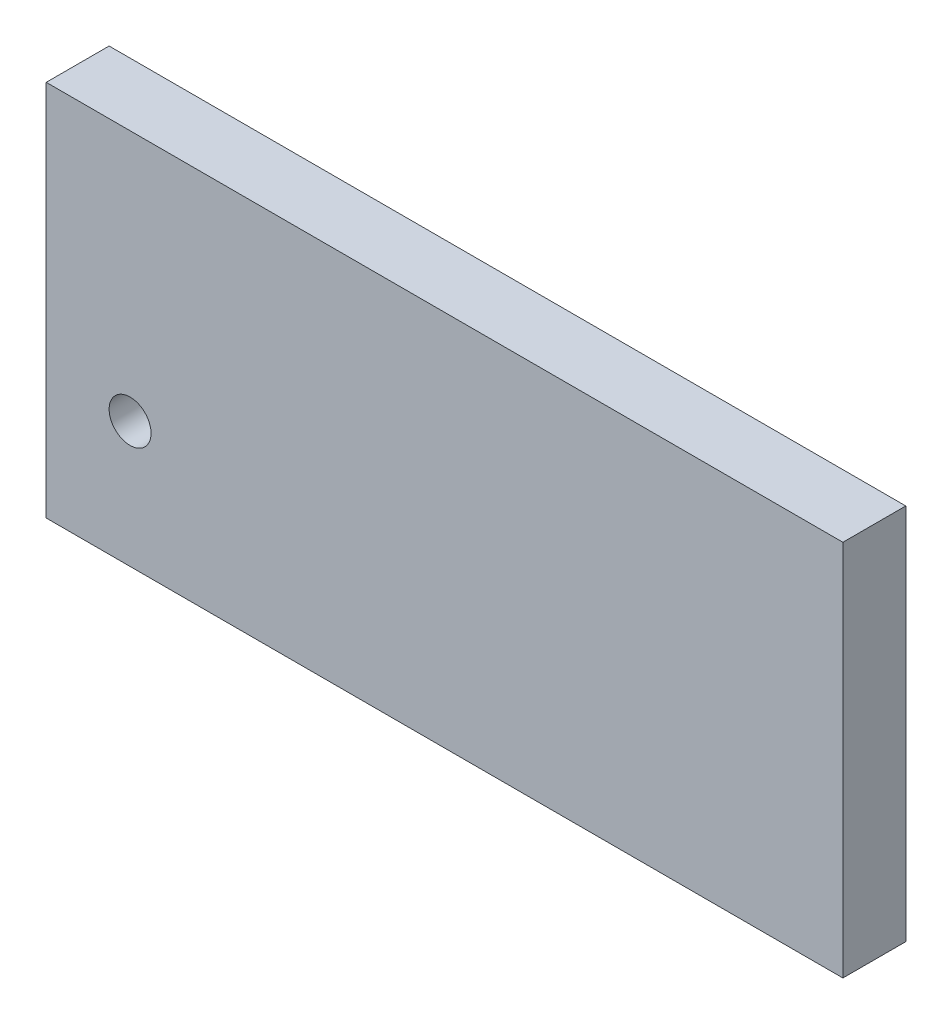
from build123d import *

# Parameters (mm, degrees)
SKETCH2_W           = 241.3
SKETCH2_H           = 114.3
SKETCH2_R           = 6.35
BOSS_EXTRUDE1_DEPTH = 19.05


with BuildPart() as part:
    # Sketch2 → Boss-Extrude1 (new body)
    with BuildSketch(Plane.XY):
        with Locations((372.486295427, 84.34467147)):
            Rectangle(SKETCH2_W, SKETCH2_H)
        with Locations((277.236295427, 65.29467147)):
            Circle(SKETCH2_R, mode=Mode.SUBTRACT)
    extrude(amount=BOSS_EXTRUDE1_DEPTH)


solid = part.part
